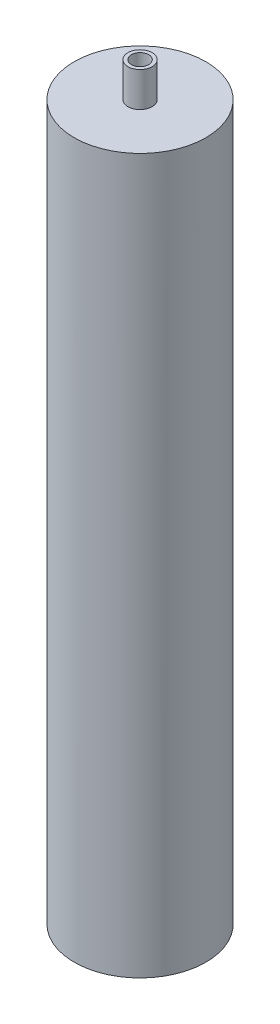
from build123d import *

# Parameters (mm, degrees)
SKETCH_1_R      = 19
SKETCH_1_R_2    = 18
EXTRUDE_1_DEPTH = 150
SKETCH_2_R      = 19
SKETCH_2_R_2    = 2
SKETCH_2_R_3    = 2.5
EXTRUDE_2_DEPTH = 2
SKETCH_3_R      = 19
SKETCH_3_R_2    = 18
EXTRUDE_3_DEPTH = 50
SKETCH_4_R      = 19
SKETCH_4_R_2    = 2.5
EXTRUDE_4_DEPTH = 2
SKETCH_5_R      = 3.5
SKETCH_5_R_2    = 2.5
EXTRUDE_5_DEPTH = 10
EXTRUDE_START   = 2
SKETCH_6_R      = 19
SKETCH_6_R_2    = 12.5
EXTRUDE_6_DEPTH = 2


with BuildPart() as part:
    # 草图1 → 凸台-拉伸1 (new body)
    with BuildSketch(Plane(origin=(0, 0, 0), x_dir=(1, 0, 0), z_dir=(0, 1, 0))):
        Circle(SKETCH_1_R)
        Circle(SKETCH_1_R_2, mode=Mode.SUBTRACT)
    extrude(amount=EXTRUDE_1_DEPTH)

    # 草图2 → 凸台-拉伸2 (add)
    with BuildSketch(Plane(origin=(0, 150, 0), x_dir=(1, 0, 0), z_dir=(0, 1, 0))):
        Circle(SKETCH_2_R)
        with Locations((0, 10)):
            Circle(SKETCH_2_R_2, mode=Mode.SUBTRACT)
        with Locations((10, 0)):
            Circle(SKETCH_2_R_2, mode=Mode.SUBTRACT)
        with Locations((-10, 0)):
            Circle(SKETCH_2_R_2, mode=Mode.SUBTRACT)
        with Locations((0, -10)):
            Circle(SKETCH_2_R_2, mode=Mode.SUBTRACT)
        Circle(SKETCH_2_R_3, mode=Mode.SUBTRACT)
    extrude(amount=EXTRUDE_2_DEPTH)

    # 草图3 → 凸台-拉伸3 (add)
    with BuildSketch(Plane(origin=(0, 152, 0), x_dir=(1, 0, 0), z_dir=(0, 1, 0))):
        Circle(SKETCH_3_R)
        Circle(SKETCH_3_R_2, mode=Mode.SUBTRACT)
    extrude(amount=EXTRUDE_3_DEPTH)

    # 草图4 → 凸台-拉伸4 (add)
    with BuildSketch(Plane(origin=(0, 202, 0), x_dir=(1, 0, 0), z_dir=(0, 1, 0))):
        Circle(SKETCH_4_R)
        Circle(SKETCH_4_R_2, mode=Mode.SUBTRACT)
    extrude(amount=EXTRUDE_4_DEPTH)

    # 草图5 → 凸台-拉伸5 (add)
    with BuildSketch(Plane(origin=(0, 204, 0), x_dir=(1, 0, 0), z_dir=(0, 1, 0))):
        Circle(SKETCH_5_R)
        Circle(SKETCH_5_R_2, mode=Mode.SUBTRACT)
    extrude(amount=EXTRUDE_5_DEPTH)

    # 草图6 → 凸台-拉伸6 (add)
    with BuildSketch(Plane.XZ.offset(EXTRUDE_START)):
        Circle(SKETCH_6_R)
        Circle(SKETCH_6_R_2, mode=Mode.SUBTRACT)
    extrude(amount=-EXTRUDE_6_DEPTH)


solid = part.part
